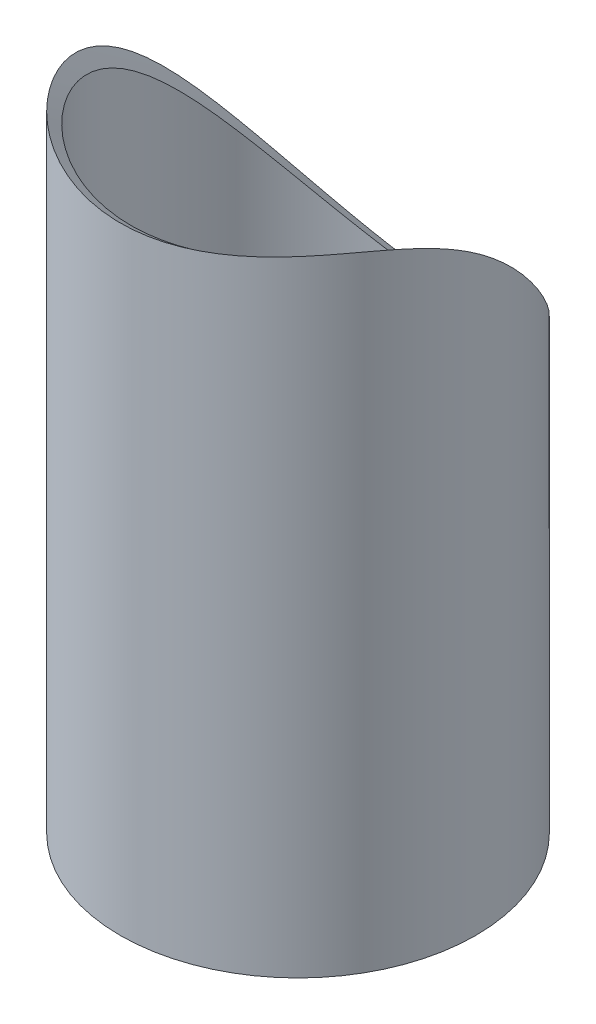
from build123d import *

# Parameters (mm, degrees)
EXTRUDE_1_OUTLINE_R      = 50
EXTRUDE_1_OUTLINE_R_2    = 47
EXTRUDE_1_DEPTH          = 200
CUT_EXTRUDE_1_DEPTH      = 213.132034356
CUT_EXTRUDE_1_DEPTH_BACK = 213.132034356
SKETCH_2_R               = 66.5


# Read off the part's stored shape, not the designer's step: Вытянуть-Тонкостенный1
with BuildPart() as part:
    # Вытянуть-Тонкостенный1 outline → Вытянуть-Тонкостенный1 (new body)
    with BuildSketch(Plane(origin=(0, 0, 0), x_dir=(1, 0, 0), z_dir=(0, 1, 0))):
        Circle(EXTRUDE_1_OUTLINE_R)
        Circle(EXTRUDE_1_OUTLINE_R_2, mode=Mode.SUBTRACT)
    extrude(amount=EXTRUDE_1_DEPTH)

    # Эскиз2 → Вырез-Вытянуть1 (cut, two sides: drawn at the far end of the back side and taken through both)
    with BuildSketch(Plane(origin=(0, 0, 0), x_dir=(1, 0, 0), z_dir=(0, -0.5735764363510444, -0.819152044288993)).offset(-CUT_EXTRUDE_1_DEPTH_BACK)):
        with Locations((0, -180)):
            Circle(SKETCH_2_R)
    extrude(amount=CUT_EXTRUDE_1_DEPTH + CUT_EXTRUDE_1_DEPTH_BACK, mode=Mode.SUBTRACT)


solid = part.part
